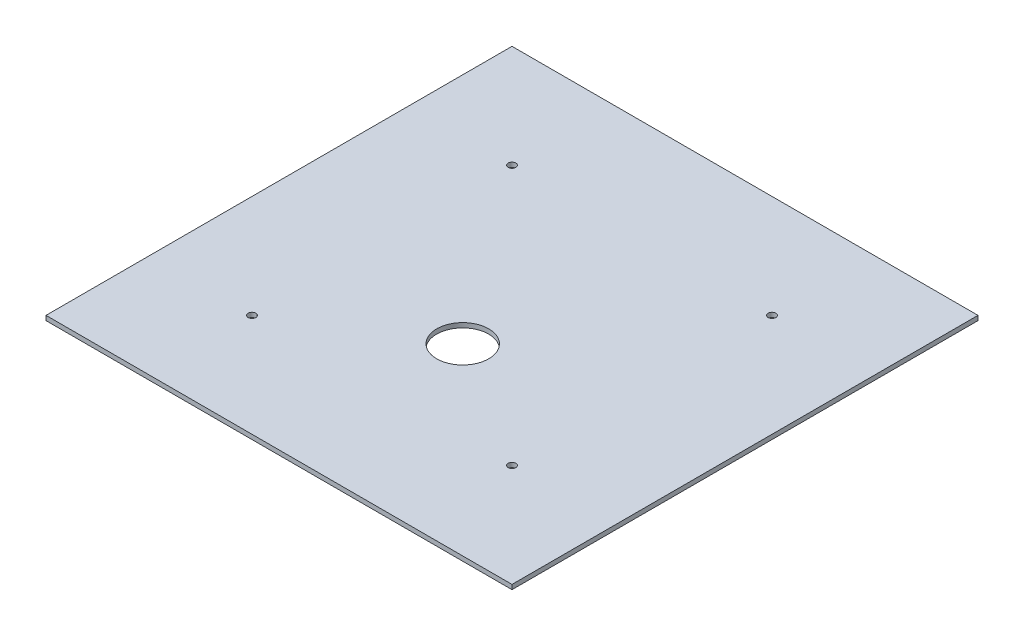
from build123d import *

# Parameters (mm, degrees)
SKETCH2_W           = 304.8
SKETCH2_H           = 304.8
BOSS_EXTRUDE1_DEPTH = 3
SKETCH3_R           = 2.5
CUT_EXTRUDE1_DEPTH  = 216.547025032
SKETCH4_R           = 17
CUT_EXTRUDE2_DEPTH  = 216.547025032


with BuildPart() as part:
    # Sketch2 → Boss-Extrude1 (new body)
    with BuildSketch(Plane(origin=(0, 0, 0), x_dir=(1, 0, 0), z_dir=(0, 1, 0))):
        Rectangle(SKETCH2_W, SKETCH2_H)
    extrude(amount=BOSS_EXTRUDE1_DEPTH)

    # Sketch3 → Cut-Extrude1 (cut, through all)
    with BuildSketch(Plane(origin=(0, 3, 0), x_dir=(1, 0, 0), z_dir=(0, 1, 0))):
        with Locations((-85.035, 85.035)):
            Circle(SKETCH3_R)
        with Locations((85.035, 85.035)):
            Circle(SKETCH3_R)
        with Locations((-85.035, -85.035)):
            Circle(SKETCH3_R)
        with Locations((85.035, -85.035)):
            Circle(SKETCH3_R)
    extrude(amount=-CUT_EXTRUDE1_DEPTH, mode=Mode.SUBTRACT)

    # Sketch4 → Cut-Extrude2 (cut, through all)
    with BuildSketch(Plane(origin=(0, 3, 0), x_dir=(1, 0, 0), z_dir=(0, 1, 0))):
        with Locations((0, -32.24)):
            Circle(SKETCH4_R)
    extrude(amount=-CUT_EXTRUDE2_DEPTH, mode=Mode.SUBTRACT)


solid = part.part
